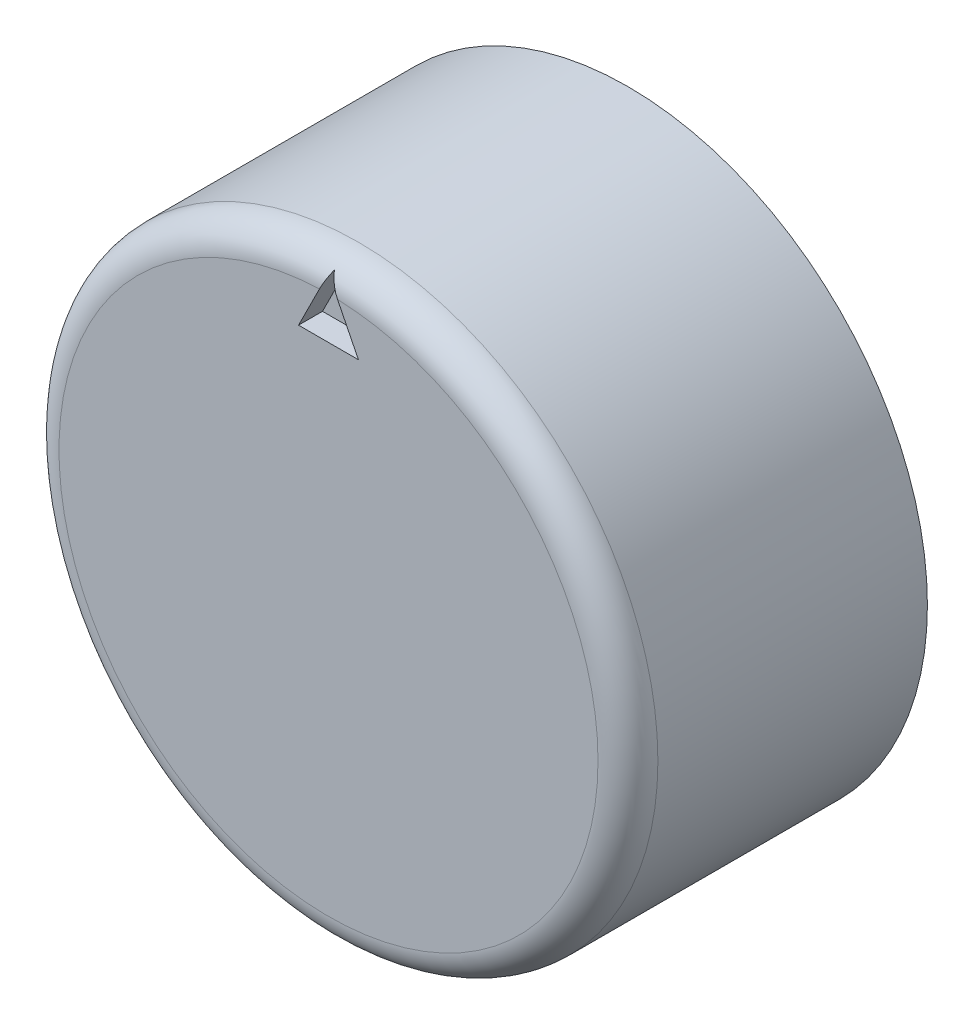
from build123d import *

# Parameters (mm, degrees)
SKETCH1_R           = 12.7
BOSS_EXTRUDE1_DEPTH = 12.7
SKETCH2_R           = 3.0988
CUT_EXTRUDE1_DEPTH  = 7.62
BOSS_EXTRUDE3_START = 1.016
BOSS_EXTRUDE3_DEPTH = 1.016
SKETCH4_R           = 10.16
SKETCH4_R_2         = 5.08
CUT_EXTRUDE2_DEPTH  = 10.16
CUT_EXTRUDE3_DEPTH  = 1.016
FILLET1_R           = 1.27
FILLET2_R           = 0.381


# Some blends are built 0.0001 mm under size
with BuildPart() as part:
    # Sketch1 → Boss-Extrude1 (new body)
    with BuildSketch(Plane.XY):
        Circle(SKETCH1_R)
    extrude(amount=BOSS_EXTRUDE1_DEPTH)

    # Sketch2 → Cut-Extrude1 (cut)
    with BuildSketch(Plane(origin=(0, 0, 0), x_dir=(-1, 0, 0), z_dir=(0, 0, -1))):
        Circle(SKETCH2_R)
    extrude(amount=-CUT_EXTRUDE1_DEPTH, mode=Mode.SUBTRACT)

    # Sketch3 → Boss-Extrude3 (add)
    with BuildSketch(Plane(origin=(0, 0, 7.62), x_dir=(-1, 0, 0), z_dir=(0, 0, -1)).offset(BOSS_EXTRUDE3_START)):
        with BuildLine():
            Line((-3.075288676, 0.381), (3.075288676, 0.381))
            ThreePointArc((3.075288676, 0.381), (3.0988, 0), (3.075288676, -0.381))
            Line((3.075288676, -0.381), (-3.075288676, -0.381))
            ThreePointArc((-3.075288676, -0.381), (-3.0988, 0), (-3.075288676, 0.381))
        make_face()
    extrude(amount=-BOSS_EXTRUDE3_DEPTH)

    # Sketch4 → Cut-Extrude2 (cut)
    with BuildSketch(Plane(origin=(0, 0, 0), x_dir=(-1, 0, 0), z_dir=(0, 0, -1))):
        Circle(SKETCH4_R)
        Circle(SKETCH4_R_2, mode=Mode.SUBTRACT)
    extrude(amount=-CUT_EXTRUDE2_DEPTH, mode=Mode.SUBTRACT)

    # Sketch5 → Cut-Extrude3 (cut)
    with BuildSketch(Plane.XY.offset(12.7)):
        Polygon((0, 12.192), (-1.27, 9.652), (1.27, 9.652), align=None)
    extrude(amount=-CUT_EXTRUDE3_DEPTH, mode=Mode.SUBTRACT)

    # Fillet1
    # the kernel refuses this fillet: 1.27 mm, written as the material it adds along each edge
    with BuildSketch(Plane(origin=(0, 0, 10.16), x_dir=(-1, 0, 0), z_dir=(0, -1, 0))) as fillet1_piece_1:
        with BuildLine():
            CenterArc((10.16 - FILLET1_R, FILLET1_R), FILLET1_R, 270, 90)
            Line((10.16 - FILLET1_R, 0), (10.16, 0))
            Line((10.16, 0), (10.16, FILLET1_R))
        make_face()
    revolve(axis=Axis((0, 0, 10.16), (0, 0, -1)))
    with BuildSketch(Plane(origin=(0, 0, 10.16), x_dir=(-1, 0, 0), z_dir=(0, -1, 0))) as fillet1_piece_2:
        with BuildLine():
            CenterArc((5.08 + FILLET1_R, FILLET1_R), FILLET1_R, 180, 90)
            Line((5.08, FILLET1_R), (5.08, 0))
            Line((5.08, 0), (5.08 + FILLET1_R, 0))
        make_face()
    revolve(axis=Axis((0, 0, 10.16), (0, 0, -1)))
    # the kernel refuses this fillet: 1.27 mm, written as the material it takes off along each edge
    with BuildSketch(Plane(origin=(0, 0, 0), x_dir=(-1, 0, 0), z_dir=(0, -1, 0))) as fillet1_2_piece_1:
        with BuildLine():
            CenterArc((10.16 + FILLET1_R, -FILLET1_R), FILLET1_R, 90, 90)
            Line((10.16, -FILLET1_R), (10.16, 0))
            Line((10.16, 0), (10.16 + FILLET1_R, 0))
        make_face()
    revolve(axis=Axis((0, 0, 0), (0, 0, -1)), mode=Mode.SUBTRACT)
    with BuildSketch(Plane(origin=(0, 0, 12.7), x_dir=(1, 0, 0), z_dir=(0, -1, 0))) as fillet1_2_piece_2:
        with BuildLine():
            CenterArc((12.7 - FILLET1_R, -FILLET1_R), FILLET1_R, 0, 90)
            Line((12.7 - FILLET1_R, 0), (12.7, 0))
            Line((12.7, 0), (12.7, -FILLET1_R))
        make_face()
    revolve(axis=Axis((0, 0, 12.7), (0, 0, 1)), mode=Mode.SUBTRACT)
    with BuildSketch(Plane(origin=(0, 0, 0), x_dir=(-1, 0, 0), z_dir=(0, -1, 0))) as fillet1_2_piece_3:
        with BuildLine():
            CenterArc((3.0988 + FILLET1_R, -FILLET1_R), FILLET1_R, 90, 90)
            Line((3.0988, -FILLET1_R), (3.0988, 0))
            Line((3.0988, 0), (3.0988 + FILLET1_R, 0))
        make_face()
    revolve(axis=Axis((0, 0, 0), (0, 0, -1)), mode=Mode.SUBTRACT)

    # Fillet2
    fillet2_edges = [part.edges().sort_by_distance(p)[0] for p in [
        (0, 0.381, 6.604),
        (0, -0.381, 6.604),
    ]]
    fillet(fillet2_edges, radius=FILLET2_R - 0.0001)  # a hair under: the kernel refuses the full size


solid = part.part
